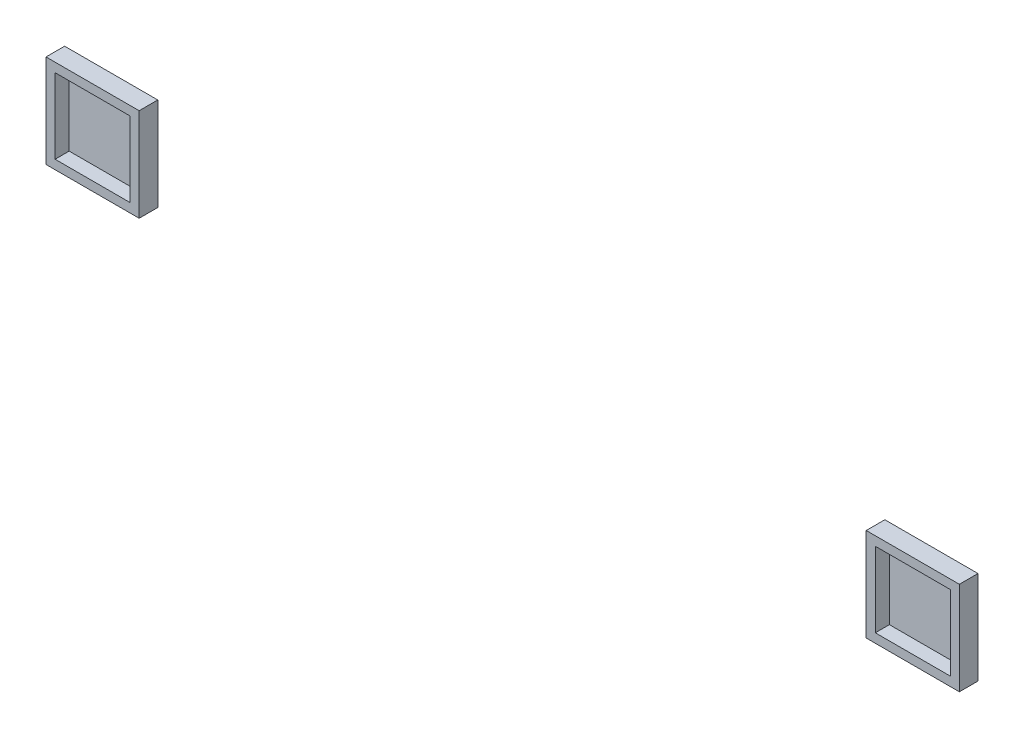
from build123d import *

# Parameters (mm, degrees)
SKETCH1_W             = 52.07
SKETCH1_H             = 52.07
SKETCH1_W_2           = 41.91
SKETCH1_H_2           = 41.91
BOSS_EXTRUDE1_DEPTH   = 7.874
BOSS_EXTRUDE1_2_DEPTH = 7.874
SKETCH3_W             = 52.07
SKETCH3_H             = 52.07
BOSS_EXTRUDE6_DEPTH   = 2.54


with BuildPart() as part:
    # Sketch1 → Boss-Extrude1 (new body)
    with BuildSketch(Plane.XY):
        with Locations((20.955, 20.955)):
            Rectangle(SKETCH1_W, SKETCH1_H)
        with Locations((20.955, 20.955)):
            Rectangle(SKETCH1_W_2, SKETCH1_H_2, mode=Mode.SUBTRACT)
    extrude(amount=BOSS_EXTRUDE1_DEPTH)



with BuildPart() as body_2:
    # Sketch1 → Boss-Extrude1 2 (new body)
    with BuildSketch(Plane.XY):
        with Locations((479.425, 20.955)):
            Rectangle(SKETCH1_W, SKETCH1_H)
        with Locations((479.425, 20.955)):
            Rectangle(SKETCH1_W_2, SKETCH1_H_2, mode=Mode.SUBTRACT)
    extrude(amount=BOSS_EXTRUDE1_2_DEPTH)


with BuildPart() as part_1:
    add(part.part)

    add(body_2.part)  # Boss-Extrude6 merges body 2
    # Sketch3 → Boss-Extrude6 (add)
    with BuildSketch(Plane(origin=(0, 0, 0), x_dir=(-1, 0, 0), z_dir=(0, 0, -1))):
        with Locations((-20.955, 20.955)):
            Rectangle(SKETCH3_W, SKETCH3_H)
        with Locations((-479.425, 20.955)):
            Rectangle(SKETCH3_W, SKETCH3_H)
    extrude(amount=BOSS_EXTRUDE6_DEPTH)


solid = part_1.part
